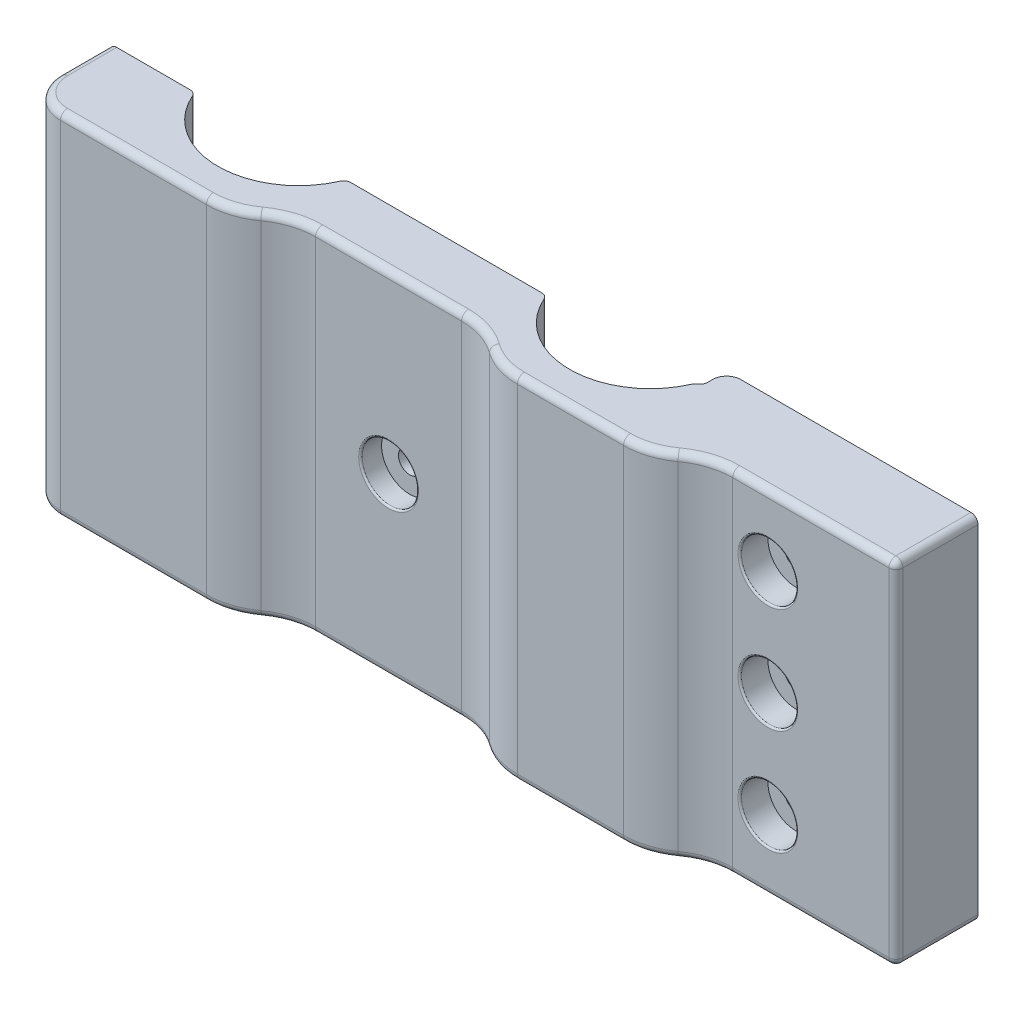
from build123d import *

# Parameters (mm, degrees)
ESQUISSE1_W             = 120
ESQUISSE1_H             = 50
BOSS_EXTRU_1_DEPTH      = 12
EMPREINTE1_START        = -25
EMPREINTE1_DEPTH        = 50
ESQUISSE3_W             = 28.527892604
ESQUISSE3_H             = 3.798130957
ENL_V_MAT_EXTRU_4_DEPTH = 80.018985061
CONG_2_R                = 10
CONG_3_R                = 10
ESQUISSE4_R             = 1.6
ENL_V_MAT_EXTRU_5_DEPTH = 15
ESQUISSE5_R             = 4
ENL_V_MAT_EXTRU_6_DEPTH = 3
CONG_4_R                = 0.25
CONG_5_R                = 5
ESQUISSE7_R             = 1.6
ENL_V_MAT_EXTRU_7_DEPTH = 33
ESQUISSE8_W             = 27.093233952
ESQUISSE8_H             = 3.798130957
ENL_V_MAT_EXTRU_8_DEPTH = 80.018985061
CONG_6_R                = 10
CONG_7_R                = 10
ESQUISSE9_R             = 4
ENL_V_MAT_EXTRU_9_DEPTH = 4
CONG_8_R                = 0.25
CONG_9_R                = 1
CONG_10_R               = 1
BOSS_EXTRU_2_DEPTH      = 50
CONG_11_R               = 1
CONG_12_R               = 1


# Read off the part's stored shape, not the designer's step: Empreinte1
with BuildPart() as part:
    # Esquisse1 → Boss.-Extru.1 (new body)
    with BuildSketch(Plane.XY):
        Rectangle(ESQUISSE1_W, ESQUISSE1_H)
    extrude(amount=BOSS_EXTRU_1_DEPTH)

    # Empreinte1 outline → Empreinte1 (cut)
    with BuildSketch(Plane(origin=(0, 0, 0), x_dir=(1, 0, 0), z_dir=(0, 1, 0)).offset(EMPREINTE1_START)):
        with BuildLine():
            Line((-26.406373523, 0), (-47.878480919, 0))
            ThreePointArc((-47.878480919, 0), (-37.142427221, -7.457), (-26.406373523, 0))
        make_face()
        with BuildLine():
            Line((23.593626477, 0), (2.121519081, 0))
            ThreePointArc((2.121519081, 0), (12.857572779, -7.457), (23.593626477, 0))
        make_face()
    extrude(amount=EMPREINTE1_DEPTH, mode=Mode.SUBTRACT)

    # Esquisse3 → Enlèv. mat.-Extru.4 (cut, through all)
    with BuildSketch(Plane(origin=(0, 25, 0), x_dir=(1, 0, 0), z_dir=(0, 1, 0))):
        with Locations((-12.142427221, -10.100934522)):
            Rectangle(ESQUISSE3_W, ESQUISSE3_H)
    extrude(amount=-ENL_V_MAT_EXTRU_4_DEPTH, mode=Mode.SUBTRACT)

    # Congé2
    # the kernel refuses this fillet: 10 mm, written as the material it takes off along each edge
    with BuildSketch(Plane(origin=(-26.406373523, 44.611352002, 12), x_dir=(0, 0, -1), z_dir=(0, -1, 0))) as cong_2_piece_1:
        with BuildLine():
            CenterArc((10, -7.844540801), CONG_2_R, 128.329784501, 51.670215499)
            Line((0, -7.844540801), (-0.2, -7.844540801))
            Line((-0.2, -7.844540801), (-0.2, 0))
            Line((-0.2, 0), (0, 0.2))
            ThreePointArc((0, 0.2), (1.899065478, 0.2), (3.674093576, 0.156890816))
            Line((3.674093576, 0.156890816), (3.798130957, 0))
        make_face()
    extrude(amount=89.222704003, mode=Mode.SUBTRACT)
    with BuildSketch(Plane(origin=(2.121519081, 44.611352002, 12), x_dir=(1, 0, 0), z_dir=(0, -1, 0))) as cong_2_piece_2:
        with BuildLine():
            CenterArc((7.844540801, -10), CONG_2_R, 90, 51.670215499)
            Line((0, -3.798130957), (-0.156890816, -3.674093576))
            ThreePointArc((-0.156890816, -3.674093576), (-0.2, -1.899065478), (-0.2, 0))
            Line((-0.2, 0), (0, 0.2))
            Line((0, 0.2), (7.844540801, 0.2))
            Line((7.844540801, 0.2), (7.844540801, 0))
        make_face()
    extrude(amount=89.222704003, mode=Mode.SUBTRACT)

    # Congé3
    cong_3_edges = [part.edges().sort_by_distance(p)[0] for p in [
        (2.121519081, 0, 8.201869043),
        (-26.406373523, 0, 8.201869043),
    ]]
    fillet(cong_3_edges, radius=CONG_3_R)

    # Esquisse4 → Enlèv. mat.-Extru.5 (cut)
    with BuildSketch(Plane.XY.offset(8.201869043)):
        with Locations((-12.142427221, 0)):
            Circle(ESQUISSE4_R)
    extrude(amount=-ENL_V_MAT_EXTRU_5_DEPTH, mode=Mode.SUBTRACT)

    # Esquisse5 → Enlèv. mat.-Extru.6 (cut)
    with BuildSketch(Plane.XY.offset(8.201869043)):
        with Locations((-12.142427221, 0)):
            Circle(ESQUISSE5_R)
    extrude(amount=-ENL_V_MAT_EXTRU_6_DEPTH, mode=Mode.SUBTRACT)

    # Congé4
    cong_4_edges = [part.edges().sort_by_distance(p)[0] for p in [
        (-16.142427221, 0, 8.201869043),
    ]]
    fillet(cong_4_edges, radius=CONG_4_R)

    # Congé5
    cong_5_edges = [part.edges().sort_by_distance(p)[0] for p in [
        (-60, 0, 12),
    ]]
    fillet(cong_5_edges, radius=CONG_5_R)

    # Esquisse7 → Enlèv. mat.-Extru.7 (cut)
    with BuildSketch(Plane.XY.offset(12)):
        with Locations((41.796813238, 0)):
            Circle(ESQUISSE7_R)
        with Locations((41.796813238, 15)):
            Circle(ESQUISSE7_R)
        with Locations((41.796813238, -15)):
            Circle(ESQUISSE7_R)
    extrude(amount=-ENL_V_MAT_EXTRU_7_DEPTH, mode=Mode.SUBTRACT)

    # Esquisse8 → Enlèv. mat.-Extru.8 (cut, through all)
    with BuildSketch(Plane(origin=(0, 25, 0), x_dir=(1, 0, 0), z_dir=(0, 1, 0))):
        with Locations((46.453383024, -10.100934522)):
            Rectangle(ESQUISSE8_W, ESQUISSE8_H)
    extrude(amount=-ENL_V_MAT_EXTRU_8_DEPTH, mode=Mode.SUBTRACT)

    # Congé6
    # the kernel refuses this fillet: 10 mm, written as the material it takes off along each edge
    with BuildSketch(Plane(origin=(32.906766048, 44.611352002, 12), x_dir=(-1, 0, 0), z_dir=(0, -1, 0))) as cong_6_piece_1:
        with BuildLine():
            CenterArc((7.844540801, 10), CONG_6_R, 218.329784501, 51.670215499)
            Line((0, 3.798130957), (-0.156890816, 3.674093576))
            ThreePointArc((-0.156890816, 3.674093576), (-0.2, 1.899065478), (-0.2, 0))
            Line((-0.2, 0), (0, -0.2))
            Line((0, -0.2), (7.844540801, -0.2))
            Line((7.844540801, -0.2), (7.844540801, 0))
        make_face()
    extrude(amount=89.222704003, mode=Mode.SUBTRACT)

    # Congé7
    cong_7_edges = [part.edges().sort_by_distance(p)[0] for p in [
        (32.906766048, 0, 8.201869043),
    ]]
    fillet(cong_7_edges, radius=CONG_7_R)

    # Esquisse9 → Enlèv. mat.-Extru.9 (cut)
    with BuildSketch(Plane.XY.offset(8.201869043)):
        with Locations((41.796813238, 15)):
            Circle(ESQUISSE9_R)
        with Locations((41.796813238, 0)):
            Circle(ESQUISSE9_R)
        with Locations((41.796813238, -15)):
            Circle(ESQUISSE9_R)
    extrude(amount=-ENL_V_MAT_EXTRU_9_DEPTH, mode=Mode.SUBTRACT)

    # Congé8
    cong_8_edges = [part.edges().sort_by_distance(p)[0] for p in [
        (37.796813238, 15, 8.201869043),
        (37.796813238, 0, 8.201869043),
        (37.796813238, -15, 8.201869043),
    ]]
    fillet(cong_8_edges, radius=CONG_8_R)

    # Congé9
    cong_9_edges = [part.edges().sort_by_distance(p)[0] for p in [
        (48.394120374, -25, 8.201869043),
        (48.394120374, 25, 8.201869043),
        (17.514142565, 25, 12),
        (28.143674159, 25, 11.513394379),
        (28.143674159, -25, 11.513394379),
        (33.706791837, 25, 8.688474664),
        (33.706791837, -25, 8.688474664),
        (-44.625457162, 25, 12),
        (-31.169465413, 25, 11.513394379),
        (17.514142565, -25, 12),
        (6.884610971, -25, 11.513394379),
        (-31.169465413, -25, 11.513394379),
        (-12.142427221, 25, 8.201869043),
        (-12.142427221, -25, 8.201869043),
        (6.884610971, 25, 11.513394379),
        (-25.606347735, 25, 8.688474664),
        (-25.606347735, -25, 8.688474664),
        (1.321493293, 25, 8.688474664),
        (1.321493293, -25, 8.688474664),
        (-44.625457162, -25, 12),
        (-60, -25, 3.5),
        (-58.535533906, -25, 10.535533906),
        (-60, 25, 3.5),
        (-58.535533906, 25, 10.535533906),
    ]]
    fillet(cong_9_edges, radius=CONG_9_R)

    # Congé10
    cong_10_edges = [part.edges().sort_by_distance(p)[0] for p in [
        (-26.406373523, 0, 0),
        (-47.878480919, 0, 0),
        (23.593626477, 0, 0),
        (2.121519081, 0, 0),
    ]]
    fillet(cong_10_edges, radius=CONG_10_R)

    # Esquisse10 → Boss.-Extru.2 (add)
    with BuildSketch(Plane.XZ.offset(25)):
        with BuildLine():
            Line((60, 0.031786633), (24.257572779, 0.031786633))
            Line((24.257572779, 0.031786633), (24.257572779, -1.468213367))
            ThreePointArc((24.257572779, -1.468213367), (24.843359217, -2.882426929), (26.257572779, -3.468213367))
            Line((26.257572779, -3.468213367), (60, -3.468213367))
            Line((60, -3.468213367), (60, 0.031786633))
        make_face()
    extrude(amount=-BOSS_EXTRU_2_DEPTH)

    # Congé11
    cong_11_edges = [part.edges().sort_by_distance(p)[0] for p in [
        (24.257572779, 0, 4.5192e-05),
    ]]
    fillet(cong_11_edges, radius=CONG_11_R)

    # Congé12
    cong_12_edges = [part.edges().sort_by_distance(p)[0] for p in [
        (60, -25, 1.866827838),
        (60, 0, 8.201869043),
        (60, 25, 1.866827838),
        (60, 24.707106781, 7.908975824),
        (60, -24.707106781, 7.908975824),
    ]]
    fillet(cong_12_edges, radius=CONG_12_R)


solid = part.part
